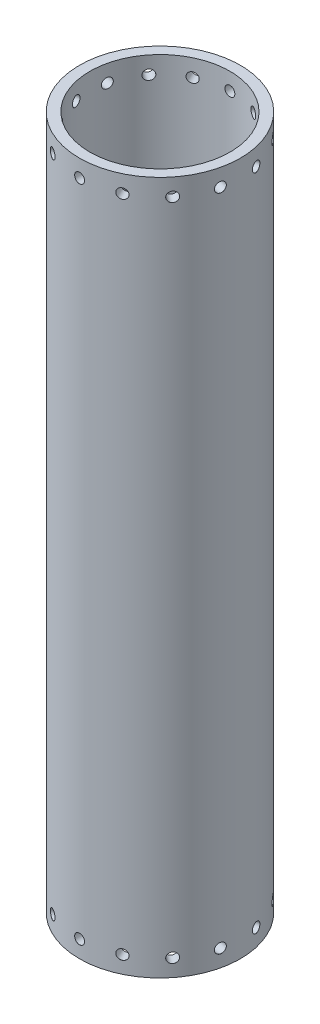
from build123d import *

# Parameters (mm, degrees)
PIPESKETCH_R      = 44.45
PIPESKETCH_R_2    = 38.71
EXTRUSION_DEPTH   = 191.5
CIRPATTERN1_COUNT = 14


# Read off the part's stored shape, not the designer's step: M5 Clearance Hole1
with BuildPart() as part:
    # PipeSketch → Extrusion (new, symmetric)
    with BuildSketch(Plane(origin=(0, 0, 0), x_dir=(1, 0, 0), z_dir=(0, 1, 0))):
        with Locations(Location((0, 0, 0), (0, 0, 270))):
            Circle(PIPESKETCH_R)
        with Locations(Location((0, 0, 0), (0, 0, 270))):
            Circle(PIPESKETCH_R_2, mode=Mode.SUBTRACT)
    extrude(amount=EXTRUSION_DEPTH, both=True)

    # M5 Clearance Hole1 outline → M5 Clearance Hole1 (revolve, cut)
    with BuildSketch(Plane.XZ.offset(182)):
        Polygon((0, -44.450019324), (2.775019324, -44.450019324), (2.749999934, -44.424999934), (2.75, -38.612181266), (0, -38.612181266), align=None)
    m5_clearance_hole1 = revolve(axis=Axis((0, -182, 0), (0, 0, 1)), mode=Mode.SUBTRACT)

    # CirPattern1: M5 Clearance Hole1 ×14 about axis
    cirpattern1_axis = Axis((0, 191.5, 0), (0, -1, 0))
    for i in range(1, CIRPATTERN1_COUNT):
        add(m5_clearance_hole1.rotate(cirpattern1_axis, i * 360 / CIRPATTERN1_COUNT), mode=Mode.SUBTRACT)

    # Mirror1: M5 Clearance Hole1 across plane
    add(m5_clearance_hole1.mirror(Plane.ZX), mode=Mode.SUBTRACT)

    # Mirror1 copy 1 sketch → Mirror1 copy 1 (revolve, cut)
    with BuildSketch(Plane(origin=(0, 182, 0), x_dir=(0.9009688679024191, 0, 0.4338837391175581), z_dir=(0, 1, 0))):
        Polygon((0, 44.450019324), (2.775019324, 44.450019324), (2.749999934, 44.424999934), (2.75, 38.612181266), (0, 38.612181266), align=None)
    revolve(axis=Axis((0, 182, 0), (0.4338837391175581, 0, -0.9009688679024191)), mode=Mode.SUBTRACT)

    # Mirror1 copy 2 sketch → Mirror1 copy 2 (revolve, cut)
    with BuildSketch(Plane(origin=(0, 182, 0), x_dir=(0.6234898018587336, 0, 0.7818314824680298), z_dir=(0, 1, 0))):
        Polygon((0, 44.450019324), (2.775019324, 44.450019324), (2.749999934, 44.424999934), (2.75, 38.612181266), (0, 38.612181266), align=None)
    revolve(axis=Axis((0, 182, 0), (0.7818314824680298, 0, -0.6234898018587336)), mode=Mode.SUBTRACT)

    # Mirror1 copy 3 sketch → Mirror1 copy 3 (revolve, cut)
    with BuildSketch(Plane(origin=(0, 182, 0), x_dir=(0.22252093395631445, 0, 0.9749279121818236), z_dir=(0, 1, 0))):
        Polygon((0, 44.450019324), (2.775019324, 44.450019324), (2.749999934, 44.424999934), (2.75, 38.612181266), (0, 38.612181266), align=None)
    revolve(axis=Axis((0, 182, 0), (0.9749279121818236, 0, -0.22252093395631445)), mode=Mode.SUBTRACT)

    # Mirror1 copy 4 sketch → Mirror1 copy 4 (revolve, cut)
    with BuildSketch(Plane(origin=(0, 182, 0), x_dir=(-0.22252093395631434, 0, 0.9749279121818236), z_dir=(0, 1, 0))):
        Polygon((0, 44.450019324), (2.775019324, 44.450019324), (2.749999934, 44.424999934), (2.75, 38.612181266), (0, 38.612181266), align=None)
    revolve(axis=Axis((0, 182, 0), (0.9749279121818236, 0, 0.22252093395631434)), mode=Mode.SUBTRACT)

    # Mirror1 copy 5 sketch → Mirror1 copy 5 (revolve, cut)
    with BuildSketch(Plane(origin=(0, 182, 0), x_dir=(-0.6234898018587338, 0, 0.7818314824680296), z_dir=(0, 1, 0))):
        Polygon((0, 44.450019324), (2.775019324, 44.450019324), (2.749999934, 44.424999934), (2.75, 38.612181266), (0, 38.612181266), align=None)
    revolve(axis=Axis((0, 182, 0), (0.7818314824680296, 0, 0.6234898018587338)), mode=Mode.SUBTRACT)

    # Mirror1 copy 6 sketch → Mirror1 copy 6 (revolve, cut)
    with BuildSketch(Plane(origin=(0, 182, 0), x_dir=(-0.900968867902419, 0, 0.43388373911755823), z_dir=(0, 1, 0))):
        Polygon((0, 44.450019324), (2.775019324, 44.450019324), (2.749999934, 44.424999934), (2.75, 38.612181266), (0, 38.612181266), align=None)
    revolve(axis=Axis((0, 182, 0), (0.43388373911755823, 0, 0.900968867902419)), mode=Mode.SUBTRACT)

    # Mirror1 copy 7 sketch → Mirror1 copy 7 (revolve, cut)
    with BuildSketch(Plane(origin=(0, 182, 0), x_dir=(-1, 0, 0), z_dir=(0, 1, 0))):
        Polygon((0, 44.450019324), (2.775019324, 44.450019324), (2.749999934, 44.424999934), (2.75, 38.612181266), (0, 38.612181266), align=None)
    revolve(axis=Axis((0, 182, 0), (0, 0, 1)), mode=Mode.SUBTRACT)

    # Mirror1 copy 8 sketch → Mirror1 copy 8 (revolve, cut)
    with BuildSketch(Plane(origin=(0, 182, 0), x_dir=(-0.9009688679024191, 0, -0.433883739117558), z_dir=(0, 1, 0))):
        Polygon((0, 44.450019324), (2.775019324, 44.450019324), (2.749999934, 44.424999934), (2.75, 38.612181266), (0, 38.612181266), align=None)
    revolve(axis=Axis((0, 182, 0), (-0.433883739117558, 0, 0.9009688679024191)), mode=Mode.SUBTRACT)

    # Mirror1 copy 9 sketch → Mirror1 copy 9 (revolve, cut)
    with BuildSketch(Plane(origin=(0, 182, 0), x_dir=(-0.6234898018587337, 0, -0.7818314824680297), z_dir=(0, 1, 0))):
        Polygon((0, 44.450019324), (2.775019324, 44.450019324), (2.749999934, 44.424999934), (2.75, 38.612181266), (0, 38.612181266), align=None)
    revolve(axis=Axis((0, 182, 0), (-0.7818314824680297, 0, 0.6234898018587337)), mode=Mode.SUBTRACT)

    # Mirror1 copy 10 sketch → Mirror1 copy 10 (revolve, cut)
    with BuildSketch(Plane(origin=(0, 182, 0), x_dir=(-0.2225209339563137, 0, -0.9749279121818237), z_dir=(0, 1, 0))):
        Polygon((0, 44.450019324), (2.775019324, 44.450019324), (2.749999934, 44.424999934), (2.75, 38.612181266), (0, 38.612181266), align=None)
    revolve(axis=Axis((0, 182, 0), (-0.9749279121818237, 0, 0.2225209339563137)), mode=Mode.SUBTRACT)

    # Mirror1 copy 11 sketch → Mirror1 copy 11 (revolve, cut)
    with BuildSketch(Plane(origin=(0, 182, 0), x_dir=(0.2225209339563151, 0, -0.9749279121818234), z_dir=(0, 1, 0))):
        Polygon((0, 44.450019324), (2.775019324, 44.450019324), (2.749999934, 44.424999934), (2.75, 38.612181266), (0, 38.612181266), align=None)
    revolve(axis=Axis((0, 182, 0), (-0.9749279121818234, 0, -0.2225209339563151)), mode=Mode.SUBTRACT)

    # Mirror1 copy 12 sketch → Mirror1 copy 12 (revolve, cut)
    with BuildSketch(Plane(origin=(0, 182, 0), x_dir=(0.6234898018587334, 0, -0.7818314824680299), z_dir=(0, 1, 0))):
        Polygon((0, 44.450019324), (2.775019324, 44.450019324), (2.749999934, 44.424999934), (2.75, 38.612181266), (0, 38.612181266), align=None)
    revolve(axis=Axis((0, 182, 0), (-0.7818314824680299, 0, -0.6234898018587334)), mode=Mode.SUBTRACT)

    # Mirror1 copy 13 sketch → Mirror1 copy 13 (revolve, cut)
    with BuildSketch(Plane(origin=(0, 182, 0), x_dir=(0.900968867902419, 0, -0.43388373911755834), z_dir=(0, 1, 0))):
        Polygon((0, 44.450019324), (2.775019324, 44.450019324), (2.749999934, 44.424999934), (2.75, 38.612181266), (0, 38.612181266), align=None)
    revolve(axis=Axis((0, 182, 0), (-0.43388373911755834, 0, -0.900968867902419)), mode=Mode.SUBTRACT)


solid = part.part
